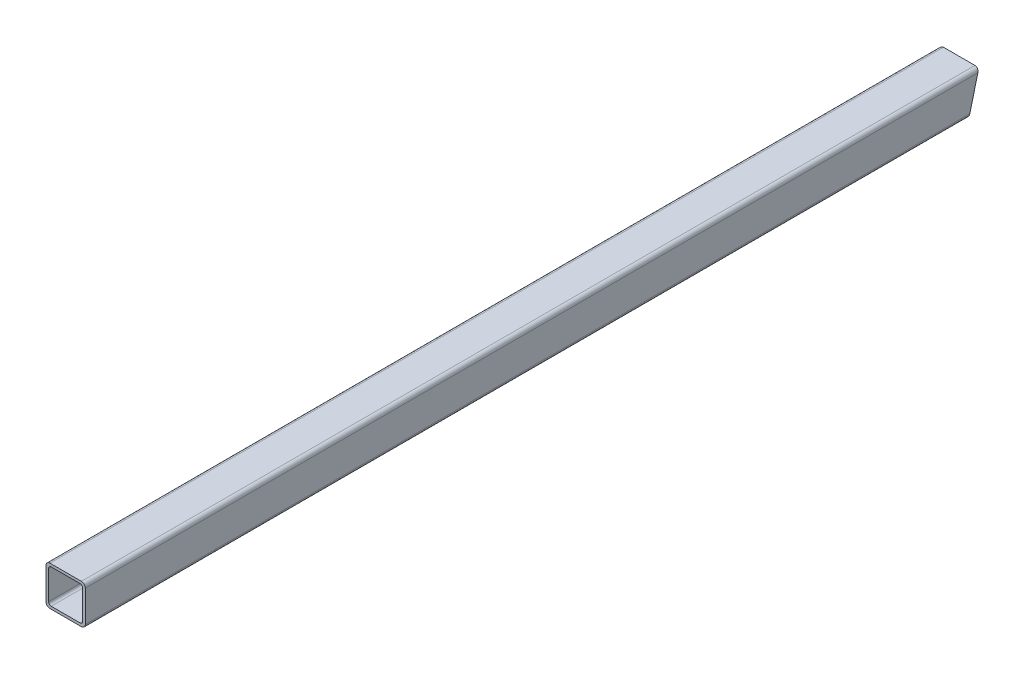
from build123d import *

# Parameters (mm, degrees)
EXTRUDE_START       = -864.980118087
EXTRUDE_1_DEPTH     = 864.980118087
CUT_EXTRUDE_1_DEPTH = 867.94325344


# Read off the part's stored shape, not the designer's step: Бобышка-Вытянуть1
with BuildPart() as part:
    # Бобышка-Вытянуть1 outline → Бобышка-Вытянуть1 (new body)
    with BuildSketch(Plane.XY.offset(EXTRUDE_START)):
        with BuildLine():
            Line((-15, -23), (-15, -47))
            ThreePointArc((-15, -47), (-14.121320344, -49.121320344), (-12, -50))
            Line((-12, -50), (12, -50))
            ThreePointArc((12, -50), (14.121320344, -49.121320344), (15, -47))
            Line((15, -47), (15, -23))
            ThreePointArc((15, -23), (14.121320344, -20.878679656), (12, -20))
            Line((12, -20), (-12, -20))
            ThreePointArc((-12, -20), (-14.121320344, -20.878679656), (-15, -23))
        make_face()
        with BuildLine():
            ThreePointArc((-11, -48), (-12.414213562, -47.414213562), (-13, -46))
            Line((-13, -46), (-13, -24))
            ThreePointArc((-13, -24), (-12.414213562, -22.585786438), (-11, -22))
            Line((-11, -22), (11, -22))
            ThreePointArc((11, -22), (12.414213562, -22.585786438), (13, -24))
            Line((13, -24), (13, -46))
            ThreePointArc((13, -46), (12.414213562, -47.414213562), (11, -48))
            Line((11, -48), (-11, -48))
        make_face(mode=Mode.SUBTRACT)
    extrude(amount=EXTRUDE_1_DEPTH)

    # Эскиз2 → Вырез-Вытянуть1 (cut, through all)
    with BuildSketch(Plane.ZY.offset(15)):
        Polygon((-682.136609507, -20), (-674.48972614, -50), (-864.980118087, -50), (-864.980118087, -20), align=None)
    extrude(amount=-CUT_EXTRUDE_1_DEPTH, mode=Mode.SUBTRACT)


solid = part.part
